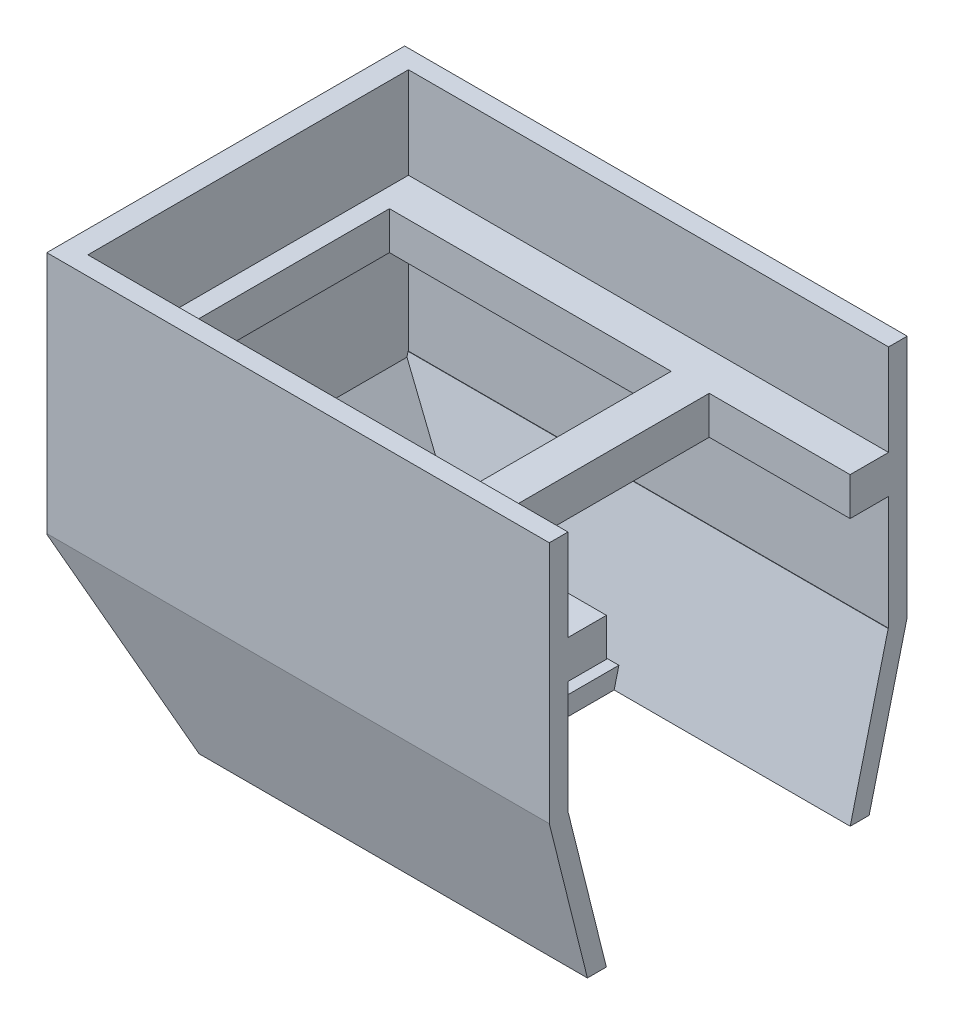
from build123d import *

# Parameters (mm, degrees)
SKETCH1_W                = 74
SKETCH1_H                = 64
BOSS_EXTRUDE3_DEPTH      = 10
BOSS_EXTRUDE4_DEPTH      = 24
BOSS_EXTRUDE4_DEPTH_BACK = 80
SKETCH3_W                = 264
SKETCH3_H                = 94
SKETCH3_W_2              = 252.2
SKETCH3_H_2              = 84.2
SKETCH4_W                = 264
SKETCH4_H                = 94
SKETCH4_W_2              = 194
SKETCH4_H_2              = 64
BOSS_EXTRUDE5_DEPTH      = 40
CHAMFER4_SIZE            = 39.811344649
CHAMFER4_SIZE_2          = 30
CHAMFER7_SIZE            = 39.811344649
CHAMFER7_SIZE_2          = 30
CHAMFER8_SIZE            = 10
CHAMFER8_SIZE_2          = 40.107809335
CHAMFER9_SIZE            = 40.107809335
CHAMFER9_SIZE_2          = 10
SKETCH7_W                = 10
SKETCH7_H                = 74
BOSS_EXTRUDE6_DEPTH      = 5


with BuildPart() as part:
    # Sketch1 → Boss-Extrude3 (new body)
    with BuildSketch(Plane(origin=(0, 0, 0), x_dir=(1, 0, 0), z_dir=(0, 1, 0))):
        Polygon((-47, 42.1), (-126.1, 42.1), (-126.1, -42.1), (-47, -42.1), (-37, -42.1), (37, -42.1), (47, -42.1), (126.1, -42.1), (126.1, 42.1), (47, 42.1), (37, 42.1), (-37, 42.1), align=None)
        with Locations((-84, 0)):
            Rectangle(SKETCH1_W, SKETCH1_H, mode=Mode.SUBTRACT)
        Rectangle(SKETCH1_W, SKETCH1_H, mode=Mode.SUBTRACT)
        with Locations((84, 0)):
            Rectangle(SKETCH1_W, SKETCH1_H, mode=Mode.SUBTRACT)
    extrude(amount=BOSS_EXTRUDE3_DEPTH)

    # Sketch3 → Boss-Extrude4 (add, two sides: drawn at the far end of the back side and taken through both)
    with BuildSketch(Plane(origin=(0, 10, 0), x_dir=(1, 0, 0), z_dir=(0, 1, 0)).offset(-BOSS_EXTRUDE4_DEPTH_BACK)):
        Rectangle(SKETCH3_W, SKETCH3_H)
        Rectangle(SKETCH3_W_2, SKETCH3_H_2, mode=Mode.SUBTRACT)
    extrude(amount=BOSS_EXTRUDE4_DEPTH + BOSS_EXTRUDE4_DEPTH_BACK)

    # Sketch4 → Boss-Extrude5 (add)
    with BuildSketch(Plane(origin=(0, -70, 0), x_dir=(-1, 0, 0), z_dir=(0, -1, 0))):
        Rectangle(SKETCH4_W, SKETCH4_H)
        Rectangle(SKETCH4_W_2, SKETCH4_H_2, mode=Mode.SUBTRACT)
    extrude(amount=-BOSS_EXTRUDE5_DEPTH)

    # Chamfer4
    # the kernel refuses this chamfer: 39.811344649, 30 mm, written as the material it takes off along each edge
    with BuildSketch(Plane(origin=(-132, -70, 149.735778307), x_dir=(-0.023321052992758384, 0.9997280272590686, 0), z_dir=(0, 0, -1))) as chamfer4_piece_1:
        Polygon((CHAMFER4_SIZE * 0.999728027249, CHAMFER4_SIZE * 0.0233210529925), (-CHAMFER4_SIZE_2 * 0.0233210529928, CHAMFER4_SIZE_2 * 0.999728027259), (0, 0), align=None)
    extrude(amount=299.471556613, mode=Mode.SUBTRACT)
    with BuildSketch(Plane(origin=(-97, -30, 32), x_dir=(-0.9991572559820394, 0.04104604510109794, 0), z_dir=(0, 0, -1))) as chamfer4_piece_2_section:
        Polygon((CHAMFER4_SIZE_2 * 0.999157255982, -CHAMFER4_SIZE_2 * 0.0410460451011), (-CHAMFER4_SIZE * 0.0410460451007, -CHAMFER4_SIZE * 0.999157255972), (0, 0), align=None)
    chamfer4_piece_2 = extrude(amount=64, mode=Mode.PRIVATE)
    chamfer4_piece_2 = split(chamfer4_piece_2, bisect_by=Plane(origin=(-126.1, -43.282043753, 0), z_dir=(1, 0, 0)), keep=Keep.TOP, mode=Mode.PRIVATE)
    add(chamfer4_piece_2, mode=Mode.SUBTRACT)

    # Chamfer7
    # the kernel refuses this chamfer: 39.811344649, 30 mm, written as the material it takes off along each edge
    with BuildSketch(Plane(origin=(132, -70, -149.735778307), x_dir=(0.02332105299275837, 0.9997280272590686, 0), z_dir=(0, 0, 1))) as chamfer7_piece_1:
        Polygon((CHAMFER7_SIZE * 0.999728027249, CHAMFER7_SIZE * 0.0233210529925), (-CHAMFER7_SIZE_2 * 0.0233210529928, CHAMFER7_SIZE_2 * 0.999728027259), (0, 0), align=None)
    extrude(amount=299.471556613, mode=Mode.SUBTRACT)
    with BuildSketch(Plane(origin=(97, -30, -32), x_dir=(0.9991572559820394, 0.04104604510109794, 0), z_dir=(0, 0, 1))) as chamfer7_piece_2_section:
        Polygon((CHAMFER7_SIZE_2 * 0.999157255982, -CHAMFER7_SIZE_2 * 0.0410460451011), (-CHAMFER7_SIZE * 0.0410460451007, -CHAMFER7_SIZE * 0.999157255972), (0, 0), align=None)
    chamfer7_piece_2 = extrude(amount=64, mode=Mode.PRIVATE)
    chamfer7_piece_2 = split(chamfer7_piece_2, bisect_by=Plane(origin=(126.1, -43.282043753, 0), z_dir=(-1, 0, 0)), keep=Keep.TOP, mode=Mode.PRIVATE)
    add(chamfer7_piece_2, mode=Mode.SUBTRACT)

    # Chamfer8
    # the kernel refuses this chamfer: 40.107809335, 10 mm, written as the material it takes off along each edge
    with BuildSketch(Plane(origin=(230.265686152, -30, -32), x_dir=(0, 0.14819517765013807, -0.9889581332499592), z_dir=(-1, 0, 0))) as chamfer8_piece_1_section:
        Polygon((CHAMFER8_SIZE * 0.98895813325, CHAMFER8_SIZE * 0.14819517765), (-CHAMFER8_SIZE_2 * 0.148195177651, CHAMFER8_SIZE_2 * 0.988958133259), (0, 0), align=None)
    chamfer8_piece_1 = extrude(amount=460.531372304, mode=Mode.PRIVATE)
    chamfer8_piece_1 = split(chamfer8_piece_1, bisect_by=Plane(origin=(97, -69.925531208, -32.022723521), z_dir=(-1, 0, 0)), keep=Keep.TOP, mode=Mode.PRIVATE)
    chamfer8_piece_1 = split(chamfer8_piece_1, bisect_by=Plane(origin=(-97, -69.925531208, -32.022723521), z_dir=(1, 0, 0)), keep=Keep.TOP, mode=Mode.PRIVATE)
    add(chamfer8_piece_1, mode=Mode.SUBTRACT)
    with BuildSketch(Plane(origin=(126.1, -30, -32), x_dir=(0, 0.14819517765040952, -0.9889581332499185), z_dir=(-1, 0, 0))) as chamfer8_piece_2_section:
        Polygon((CHAMFER8_SIZE * 0.98895813325, CHAMFER8_SIZE * 0.14819517765), (-CHAMFER8_SIZE_2 * 0.148195177652, CHAMFER8_SIZE_2 * 0.988958133259), (0, 0), align=None)
    chamfer8_piece_2 = extrude(amount=252.2, mode=Mode.PRIVATE)
    chamfer8_piece_2 = split(chamfer8_piece_2, bisect_by=Plane(origin=(115.387923489, -45.409746002, -35.753076102), z_dir=(-0.7986355100471506, 0.6018150231522371, 0)), keep=Keep.TOP, mode=Mode.PRIVATE)
    chamfer8_piece_2 = split(chamfer8_piece_2, bisect_by=Plane(origin=(-37.003214765, -149.429767809, -35.753076102), z_dir=(0.7986355100471506, 0.6018150231522371, 0)), keep=Keep.TOP, mode=Mode.PRIVATE)
    add(chamfer8_piece_2, mode=Mode.SUBTRACT)
    with BuildSketch(Plane(origin=(-206.165686152, -70, -47), x_dir=(0, 0.9999566151296001, -0.009314926653100013), z_dir=(1, 0, 0))) as chamfer8_piece_3:
        Polygon((CHAMFER8_SIZE_2 * 0.999956615139, CHAMFER8_SIZE_2 * 0.00931492665318), (-CHAMFER8_SIZE * 0.0093149266531, CHAMFER8_SIZE * 0.99995661513), (0, 0), align=None)
    extrude(amount=412.331372304, mode=Mode.SUBTRACT)

    # Chamfer9
    # the kernel refuses this chamfer: 40.107809335, 10 mm, written as the material it takes off along each edge
    with BuildSketch(Plane(origin=(-126.1, -30, 32), x_dir=(0, -0.9999566151296001, -0.009314926653099073), z_dir=(1, 0, 0))) as chamfer9_piece_1_section:
        Polygon((CHAMFER9_SIZE * 0.999956615139, -CHAMFER9_SIZE * 0.00931492665318), (-CHAMFER9_SIZE_2 * 0.00931492665339, -CHAMFER9_SIZE_2 * 0.99995661513), (0, 0), align=None)
    chamfer9_piece_1 = extrude(amount=252.2, mode=Mode.PRIVATE)
    chamfer9_piece_1 = split(chamfer9_piece_1, bisect_by=Plane(origin=(37.003214765, -149.429767809, 35.753076102), z_dir=(-0.7986355100471506, 0.6018150231522371, 0)), keep=Keep.TOP, mode=Mode.PRIVATE)
    chamfer9_piece_1 = split(chamfer9_piece_1, bisect_by=Plane(origin=(-115.387923489, -45.409746002, 35.753076102), z_dir=(0.79863551004721, 0.6018150231521583, 0)), keep=Keep.TOP, mode=Mode.PRIVATE)
    add(chamfer9_piece_1, mode=Mode.SUBTRACT)
    with BuildSketch(Plane(origin=(-230.265686152, -30, 32), x_dir=(0, -0.9999566151296001, -0.00931492665310001), z_dir=(1, 0, 0))) as chamfer9_piece_2_section:
        Polygon((CHAMFER9_SIZE * 0.999956615139, -CHAMFER9_SIZE * 0.00931492665318), (-CHAMFER9_SIZE_2 * 0.0093149266531, -CHAMFER9_SIZE_2 * 0.99995661513), (0, 0), align=None)
    chamfer9_piece_2 = extrude(amount=460.531372304, mode=Mode.PRIVATE)
    chamfer9_piece_2 = split(chamfer9_piece_2, bisect_by=Plane(origin=(97, -69.925531208, 32.022723521), z_dir=(-1, 0, 0)), keep=Keep.TOP, mode=Mode.PRIVATE)
    chamfer9_piece_2 = split(chamfer9_piece_2, bisect_by=Plane(origin=(-97, -69.925531208, 32.022723521), z_dir=(1, 0, 0)), keep=Keep.TOP, mode=Mode.PRIVATE)
    add(chamfer9_piece_2, mode=Mode.SUBTRACT)
    with BuildSketch(Plane(origin=(206.165686152, -70, 47), x_dir=(0, -0.1481951776501387, -0.9889581332499591), z_dir=(-1, 0, 0))) as chamfer9_piece_3:
        Polygon((CHAMFER9_SIZE_2 * 0.98895813325, -CHAMFER9_SIZE_2 * 0.14819517765), (-CHAMFER9_SIZE * 0.148195177651, -CHAMFER9_SIZE * 0.988958133259), (0, 0), align=None)
    extrude(amount=412.331372304, mode=Mode.SUBTRACT)

    # Split1
    split(bisect_by=Plane(origin=(0, 0, 0), x_dir=(0, 0, 1), z_dir=(1, 0, 0)), keep=Keep.BOTTOM)

    # Sketch7 → Boss-Extrude6 (add)
    with BuildSketch(Plane(origin=(0, -65, 0), x_dir=(-1, 0, 0), z_dir=(0, -1, 0))):
        with Locations((67, 0)):
            Rectangle(SKETCH7_W, SKETCH7_H)
    extrude(amount=BOSS_EXTRUDE6_DEPTH)


solid = part.part
